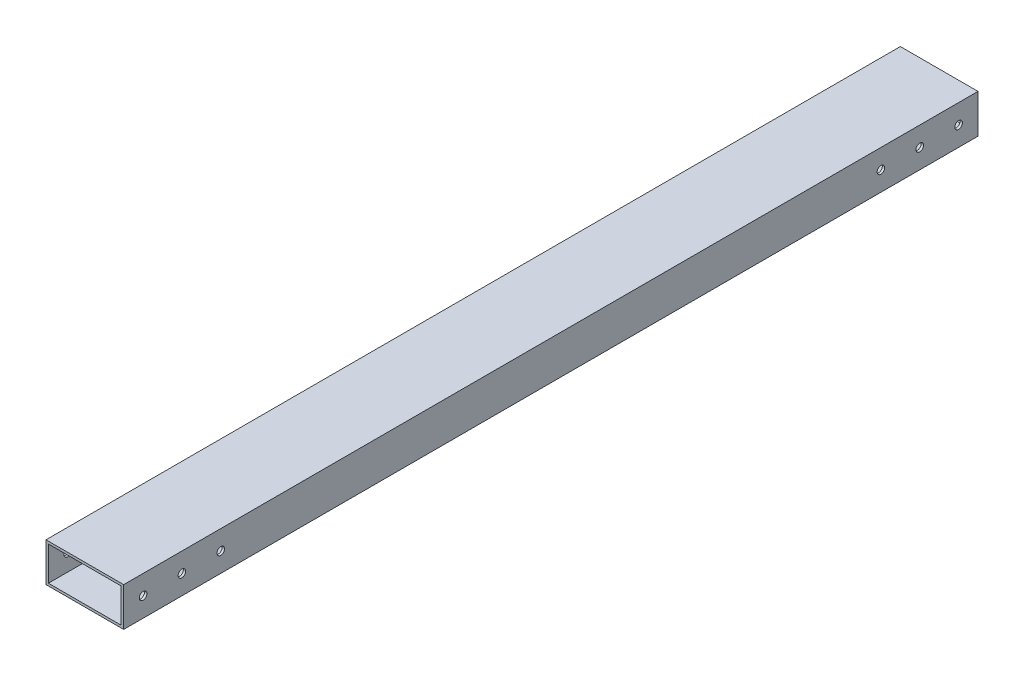
from build123d import *

# Parameters (mm, degrees)
SKETCH1_W               = 50.8
SKETCH1_H               = 25.4
BOSS_EXTRUDE1_DEPTH     = 279.4
SHELL1_T                = -1.5875
CUT_EXTRUDE1_DEPTH      = 281.839473721
CUT_EXTRUDE1_DEPTH_BACK = 281.839473721
SKETCH3_R               = 2.4892


with BuildPart() as part:
    # Sketch1 → Boss-Extrude1 (new, symmetric)
    with BuildSketch(Plane.XY):
        Rectangle(SKETCH1_W, SKETCH1_H)
    extrude(amount=BOSS_EXTRUDE1_DEPTH, both=True)

    # Shell1
    shell1_openings = [part.faces().sort_by_distance(p)[0] for p in [
        (0, 0, -279.4),
        (0, 0, 279.4),
    ]]
    offset(amount=SHELL1_T, openings=shell1_openings, kind=Kind.INTERSECTION)

    # Sketch3 → Cut-Extrude1 (cut, two sides: drawn at the far end of the back side and taken through both)
    with BuildSketch(Plane(origin=(0, 0, 0), x_dir=(0, 0, -1), z_dir=(1, 0, 0)).offset(-CUT_EXTRUDE1_DEPTH_BACK)):
        with Locations((-266.7, 0)):
            Circle(SKETCH3_R)
        with Locations((-241.3, 0)):
            Circle(SKETCH3_R)
        with Locations((-215.9, 0)):
            Circle(SKETCH3_R)
        with Locations((215.9, 0)):
            Circle(SKETCH3_R)
        with Locations((241.3, 0)):
            Circle(SKETCH3_R)
        with Locations((266.7, 0)):
            Circle(SKETCH3_R)
    extrude(amount=CUT_EXTRUDE1_DEPTH + CUT_EXTRUDE1_DEPTH_BACK, mode=Mode.SUBTRACT)


solid = part.part
